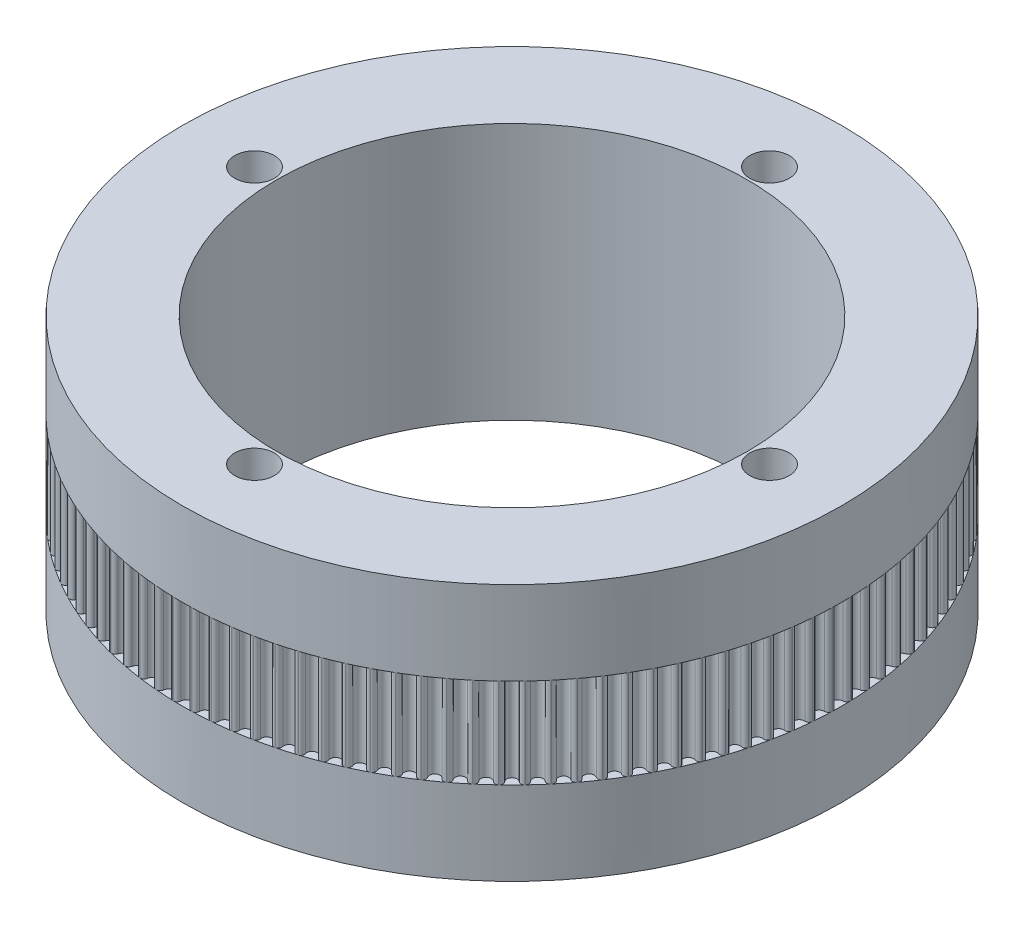
from build123d import *
from build123d.topology import SkipClean

# Parameters (mm, degrees)
CUT_EXTRUDE3_DEPTH  = 25
CIRPATTERN1_COUNT   = 112
SKETCH7_R           = 2.1
CUT_EXTRUDE5_DEPTH  = 51.392236372
CIRPATTERN2_COUNT   = 4
CIRPATTERN2_ANGLE   = 270
BOSS_EXTRUDE1_START = 8.875
SKETCH8_R           = 35
SKETCH8_R_2         = 2.1
SKETCH8_R_3         = 25
BOSS_EXTRUDE1_DEPTH = 8.875


with BuildPart() as part:
    # Skica2 → Revolute (revolve)
    with BuildSketch(Plane.XY):
        Polygon((25.783946777, -4.775), (25, -4.775), (25, 4.775), (25.489010223, 4.775), (36, 4.775), (36, 3.775), (35, 3.775), (35, -3.775), (36, -3.775), (36, -4.775), align=None)
    revolve(axis=Axis((0, -9, 0), (0, 1, 0)))

    # Sketch2 → Cut-Extrude3 (cut, symmetric)
    with BuildSketch(Plane.XZ.offset(-3.775)):
        with BuildLine():
            ThreePointArc((-0.549870829, 34.59563039), (0, 34.057549754), (0.549870829, 34.59563039))
            ThreePointArc((0.549870829, 34.59563039), (0.673966395, 34.876666046), (0.960756966, 34.98681103))
            ThreePointArc((0.960756966, 34.98681103), (1.741617328, 34.956641273), (2.521609506, 34.909045898))
            ThreePointArc((2.521609506, 34.909045898), (1.685070228, 36.378232566), (0, 36.240952722))
            ThreePointArc((0, 36.240952722), (-1.685070228, 36.378232566), (-2.521609506, 34.909045898))
            ThreePointArc((-2.521609506, 34.909045898), (-1.741617328, 34.956641273), (-0.960756966, 34.98681103))
            ThreePointArc((-0.960756966, 34.98681103), (-0.673966395, 34.876666046), (-0.549870829, 34.59563039))
        make_face()
    cut_extrude3 = extrude(amount=CUT_EXTRUDE3_DEPTH, both=True, mode=Mode.SUBTRACT)

    # CirPattern1: Cut-Extrude3 ×112 about axis
    with SkipClean():  # the faces are left unmerged after this step: merging them gives an invalid solid
        cirpattern1_axis = Axis((0, 0, 0), (0, 1, 0))
        for i in range(1, CIRPATTERN1_COUNT):
            add(cut_extrude3.rotate(cirpattern1_axis, i * 360 / CIRPATTERN1_COUNT), mode=Mode.SUBTRACT)

    # Sketch7 → Cut-Extrude5 (cut, through all)
    with BuildSketch(Plane.XZ.offset(4.775)):
        with Locations((-27.35, 0)):
            Circle(SKETCH7_R)
    cut_extrude5 = extrude(amount=-CUT_EXTRUDE5_DEPTH, mode=Mode.SUBTRACT)

    # CirPattern2: Cut-Extrude5 ×4 about axis
    cirpattern2_axis = Axis((0, 0, 0), (0, -1, 0))
    for i in range(1, CIRPATTERN2_COUNT):
        add(cut_extrude5.rotate(cirpattern2_axis, i * CIRPATTERN2_ANGLE / (CIRPATTERN2_COUNT - 1)), mode=Mode.SUBTRACT)

    # Sketch8 → Boss-Extrude1 (add)
    with BuildSketch(Plane.XZ.offset(4.775).offset(BOSS_EXTRUDE1_START)):
        Circle(SKETCH8_R)
        with Locations((-27.35, 0)):
            Circle(SKETCH8_R_2, mode=Mode.SUBTRACT)
        with Locations((0, 27.35)):
            Circle(SKETCH8_R_2, mode=Mode.SUBTRACT)
        with Locations((27.35, 0)):
            Circle(SKETCH8_R_2, mode=Mode.SUBTRACT)
        with Locations((0, -27.35)):
            Circle(SKETCH8_R_2, mode=Mode.SUBTRACT)
        Circle(SKETCH8_R_3, mode=Mode.SUBTRACT)
    boss_extrude1 = extrude(amount=-BOSS_EXTRUDE1_DEPTH)

    # Mirror2: Boss-Extrude1 across plane
    add(boss_extrude1.mirror(Plane.ZX))


solid = part.part
